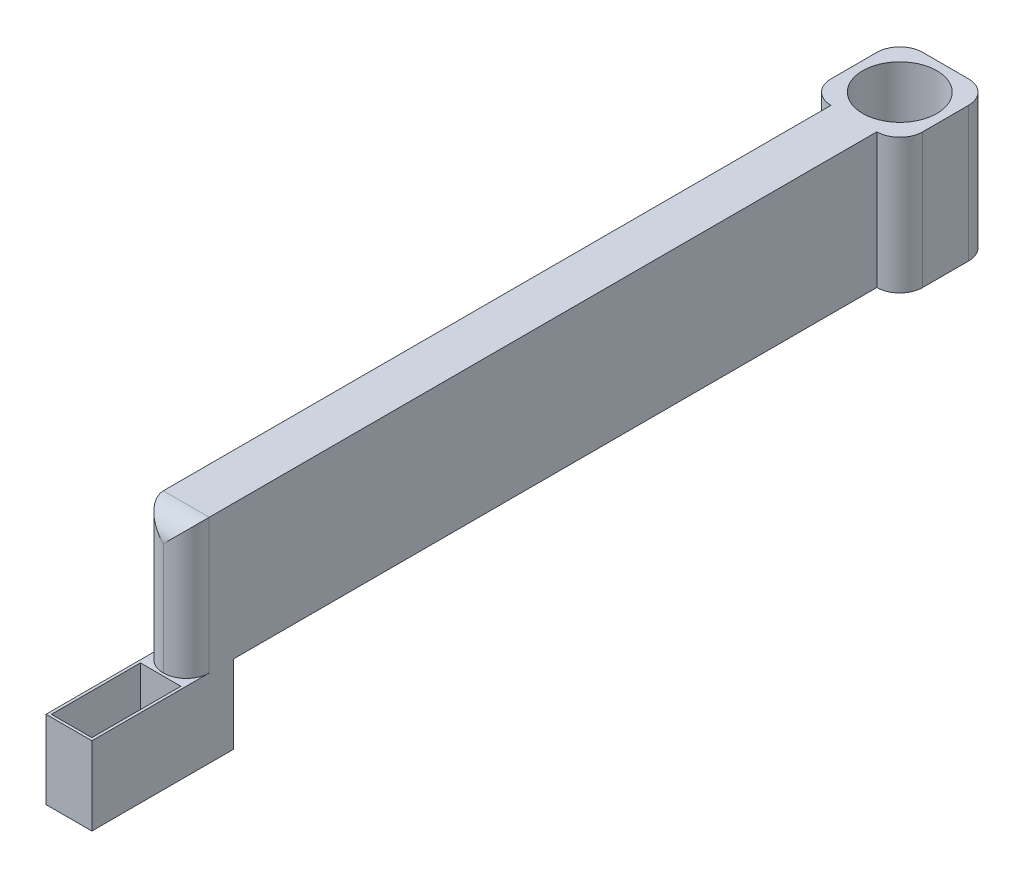
from build123d import *

# Parameters (mm, degrees)
SKETCH2_W           = 34
SKETCH2_H           = 512
SKETCH2_H_2         = 70
SKETCH2_W_2         = 68
SKETCH2_H_3         = 68
BOSS_EXTRUDE1_DEPTH = 158
FILLET1_R           = 17
SKETCH3_W           = 599.373930515
SKETCH3_H           = 58
CUT_EXTRUDE1_DEPTH  = 158
SKETCH4_W           = 68
SKETCH4_H           = 58
CUT_EXTRUDE2_DEPTH  = 158
SKETCH5_R           = 27.5
CUT_EXTRUDE3_DEPTH  = 158
SKETCH6_W           = 70
SKETCH6_H           = 100
CUT_EXTRUDE4_DEPTH  = 84
SKETCH7_W           = 30
SKETCH7_H           = 66
CUT_EXTRUDE6_DEPTH  = 56
SKETCH8_W           = 22
SKETCH8_H           = 13
CUT_EXTRUDE7_DEPTH  = 56
FILLET2_R           = 17
SKETCH9_W           = 455
SKETCH9_H           = 70
CUT_EXTRUDE8_DEPTH  = 111
SKETCH10_W          = 470.461866989
SKETCH10_H          = 86.836519433
BOSS_EXTRUDE3_DEPTH = 34


# Some blends are built 0.0001 mm under size
with BuildPart() as part:
    # Sketch2 → Boss-Extrude1 (new body)
    with BuildSketch(Plane(origin=(0, 0, 0), x_dir=(1, 0, 0), z_dir=(0, 1, 0))):
        with Locations((-34, -324)):
            Rectangle(SKETCH2_W, SKETCH2_H)
        with Locations((-34, -615)):
            Rectangle(SKETCH2_W, SKETCH2_H_2)
        with Locations((-34, -34)):
            Rectangle(SKETCH2_W_2, SKETCH2_H_3)
    extrude(amount=BOSS_EXTRUDE1_DEPTH)

    # Fillet1
    fillet1_edges = [part.edges().sort_by_distance(p)[0] for p in [
        (0, 79, 0),
        (0, 79, 68),
        (-68, 79, 0),
        (-68, 79, 68),
    ]]
    fillet(fillet1_edges, radius=FILLET1_R - 0.0001)  # a hair under: the kernel refuses the full size

    # Sketch3 → Cut-Extrude1 (cut)
    with BuildSketch(Plane.ZY.offset(51)):
        with Locations((245.313034743, 29)):
            Rectangle(SKETCH3_W, SKETCH3_H)
    extrude(amount=-CUT_EXTRUDE1_DEPTH, mode=Mode.SUBTRACT)

    # Sketch4 → Cut-Extrude2 (cut)
    with BuildSketch(Plane(origin=(-51, 0, 0), x_dir=(0, 0, -1), z_dir=(1, 0, 0))):
        with Locations((-34, 29)):
            Rectangle(SKETCH4_W, SKETCH4_H)
    extrude(amount=-CUT_EXTRUDE2_DEPTH, mode=Mode.SUBTRACT)

    # Sketch5 → Cut-Extrude3 (cut)
    with BuildSketch(Plane(origin=(0, 158, 0), x_dir=(1, 0, 0), z_dir=(0, 1, 0))):
        with Locations(Location((-34, -34, 0), (0, 0, 270))):
            Circle(SKETCH5_R)
    extrude(amount=-CUT_EXTRUDE3_DEPTH, mode=Mode.SUBTRACT)

    # Sketch6 → Cut-Extrude4 (cut)
    with BuildSketch(Plane.ZY.offset(51)):
        with Locations((615, 108)):
            Rectangle(SKETCH6_W, SKETCH6_H)
    extrude(amount=-CUT_EXTRUDE4_DEPTH, mode=Mode.SUBTRACT)

    # Sketch7 → Cut-Extrude6 (cut)
    with BuildSketch(Plane(origin=(0, 58, 0), x_dir=(1, 0, 0), z_dir=(0, 1, 0))):
        with Locations((-34, -615)):
            Rectangle(SKETCH7_W, SKETCH7_H)
    extrude(amount=-CUT_EXTRUDE6_DEPTH, mode=Mode.SUBTRACT)

    # Sketch8 → Cut-Extrude7 (cut)
    with BuildSketch(Plane(origin=(0, 2, 0), x_dir=(1, 0, 0), z_dir=(0, 1, 0))):
        with Locations((-35, -598.5)):
            Rectangle(SKETCH8_W, SKETCH8_H)
    extrude(amount=-CUT_EXTRUDE7_DEPTH, mode=Mode.SUBTRACT)

    # Fillet2
    # the kernel refuses this fillet: 17 mm, written as the material it adds along each edge
    # the kernel refuses this fillet: 17 mm, written as the material it takes off along each edge
    with BuildSketch(Plane(origin=(-93.5, 158, 580), x_dir=(0, 0, -1), z_dir=(1, 0, 0))) as fillet2_2_piece_1:
        with BuildLine():
            CenterArc((FILLET2_R, -FILLET2_R), FILLET2_R, 90, 90)
            Line((0, -FILLET2_R), (0, 0))
            Line((0, 0), (FILLET2_R, 0))
        make_face()
    extrude(amount=119, mode=Mode.SUBTRACT)
    with BuildSketch(Plane(origin=(-17, 200.5, 580), x_dir=(0, 0, -1), z_dir=(0, -1, 0))) as fillet2_2_piece_2:
        with BuildLine():
            CenterArc((FILLET2_R, -FILLET2_R), FILLET2_R, 90, 90)
            Line((0, -FILLET2_R), (0, 0))
            Line((0, 0), (FILLET2_R, 0))
        make_face()
    extrude(amount=142.5, mode=Mode.SUBTRACT)
    with BuildSketch(Plane(origin=(-51, 200.5, 580), x_dir=(0, 0, -1), z_dir=(0, -1, 0))) as fillet2_2_piece_3:
        with BuildLine():
            CenterArc((FILLET2_R, FILLET2_R), FILLET2_R, 180, 90)
            Line((0, FILLET2_R), (0, 0))
            Line((0, 0), (FILLET2_R, 0))
        make_face()
    extrude(amount=142.5, mode=Mode.SUBTRACT)

    # Sketch9 → Cut-Extrude8 (cut)
    with BuildSketch(Plane(origin=(-17, 0, 0), x_dir=(0, 0, -1), z_dir=(1, 0, 0))):
        with Locations((-315.5, 108)):
            Rectangle(SKETCH9_W, SKETCH9_H)
    extrude(amount=-CUT_EXTRUDE8_DEPTH, mode=Mode.SUBTRACT)

    # Sketch10 → Boss-Extrude3 (add)
    with BuildSketch(Plane.ZY.offset(51)):
        with Locations((313.691639381, 107.94529393)):
            Rectangle(SKETCH10_W, SKETCH10_H)
    extrude(amount=-BOSS_EXTRUDE3_DEPTH)


solid = part.part
